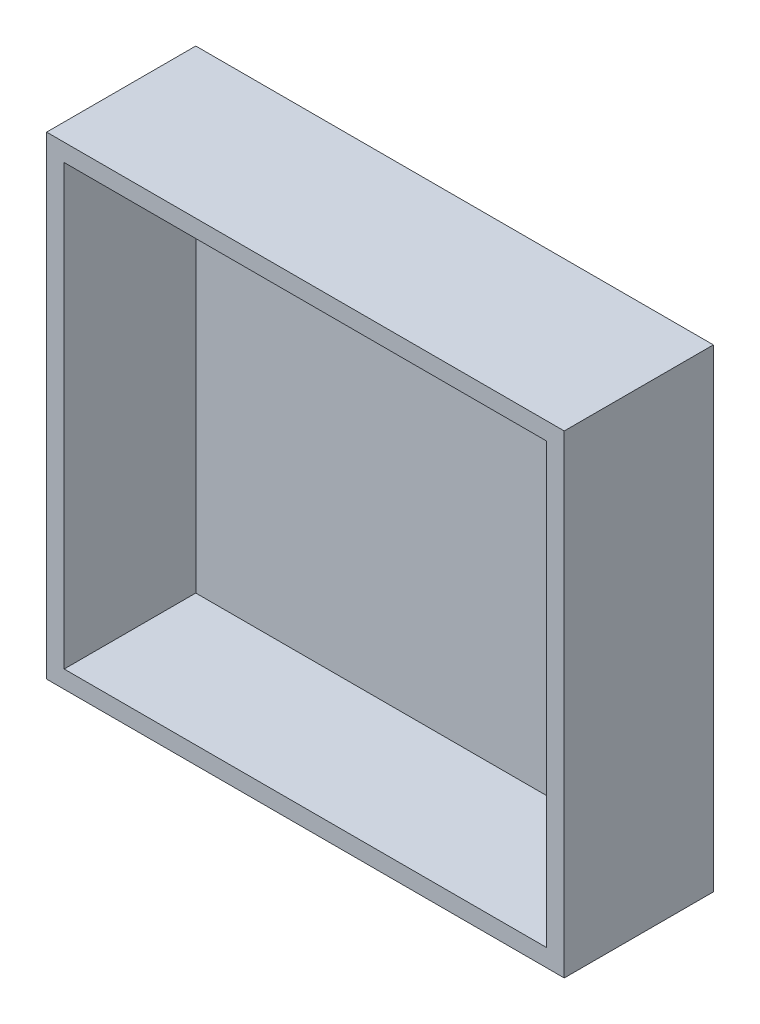
from build123d import *

# Parameters (mm, degrees)
ESQUISSE1_W        = 236
ESQUISSE1_H        = 216
ESQUISSE1_W_2      = 220
ESQUISSE1_H_2      = 200
BOSS_EXTRU_3_DEPTH = 60
ESQUISSE1_2_W      = 236
ESQUISSE1_2_H      = 216
BOSS_EXTRU_4_DEPTH = 8


with BuildPart() as part:
    # Esquisse1 → Boss.-Extru.3 (new body)
    with BuildSketch(Plane.XY):
        with Locations((110, 100)):
            Rectangle(ESQUISSE1_W, ESQUISSE1_H)
        with Locations((110, 100)):
            Rectangle(ESQUISSE1_W_2, ESQUISSE1_H_2, mode=Mode.SUBTRACT)
    extrude(amount=BOSS_EXTRU_3_DEPTH)

    # Esquisse1<2> → Boss.-Extru.4 (add)
    with BuildSketch(Plane.XY):
        with Locations((110, 100)):
            Rectangle(ESQUISSE1_2_W, ESQUISSE1_2_H)
    extrude(amount=-BOSS_EXTRU_4_DEPTH)


solid = part.part
